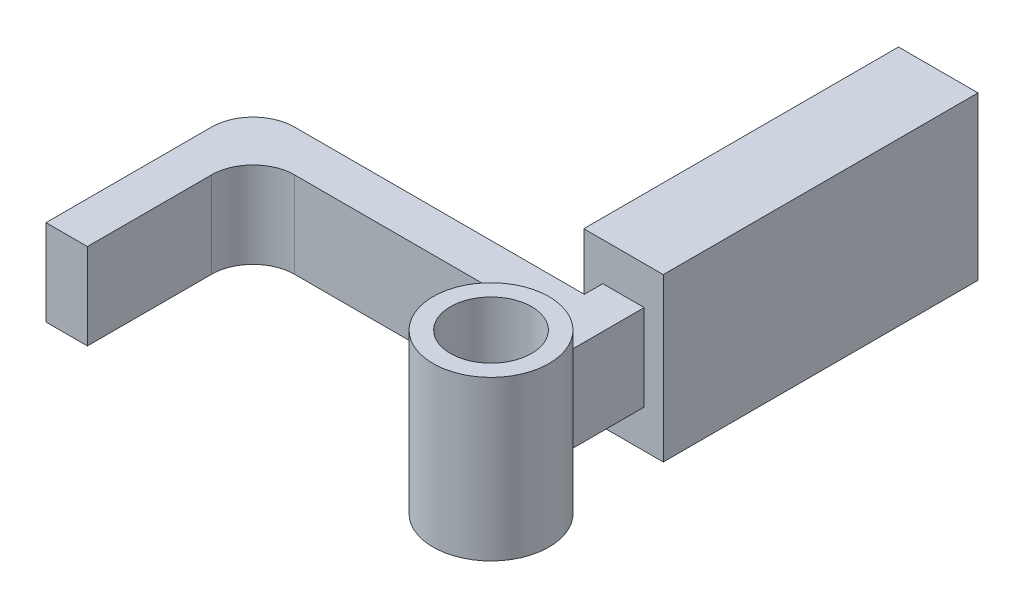
from build123d import *
from build123d.topology import SkipClean

# Parameters (mm, degrees)
SKETCH1_R                = 3.5
SKETCH1_R_2              = 2.45
HOLE_DEPTH               = 5.2
SKETCH2_W                = 2.5
SKETCH2_H                = 4.5
BOSS_EXTRUDE2_DEPTH      = 5.2
SKETCH3_W                = 4.8
SKETCH3_H                = 9.8
BOSS_EXTRUDE3_DEPTH      = 19
LEVER_ARM_DEPTH          = 5.2
BOSS_EXTRUDE4_DEPTH      = 2.2
BOSS_EXTRUDE4_DEPTH_BACK = 7.4
SKETCH6_R                = 3.5
SKETCH6_R_2              = 2.45
SCALE1_SCALE             = 0.8


with BuildPart() as part:
    # Sketch1 → hole (new body)
    with BuildSketch(Plane(origin=(0, 0, 0), x_dir=(1, 0, 0), z_dir=(0, 1, 0))):
        with Locations(Location((0, 0, 0), (0, 0, 270))):
            Circle(SKETCH1_R)
        with Locations(Location((0, 0, 0), (0, 0, 270))):
            Circle(SKETCH1_R_2, mode=Mode.SUBTRACT)
    extrude(amount=HOLE_DEPTH)

    # Sketch2 → Boss-Extrude2 (add)
    with BuildSketch(Plane.XZ):
        with Locations((0, -5.75)):
            Rectangle(SKETCH2_W, SKETCH2_H)
        with BuildLine():
            ThreePointArc((1.25, -3.269174208), (0.635566784, -3.441809824), (0, -3.5))
            Line((0, -3.5), (1.25, -3.5))
            Line((1.25, -3.5), (1.25, -3.269174208))
        make_face()
        with BuildLine():
            Line((-1.25, -3.269174208), (-1.25, -3.5))
            Line((-1.25, -3.5), (0, -3.5))
            ThreePointArc((0, -3.5), (-0.635566784, -3.441809824), (-1.25, -3.269174208))
        make_face()
    extrude(amount=-BOSS_EXTRUDE2_DEPTH)

    # Sketch3 → Boss-Extrude3 (add)
    with BuildSketch(Plane(origin=(0, 0, -8), x_dir=(-1, 0, 0), z_dir=(0, 0, -1))):
        with Locations((0, 2.6)):
            Rectangle(SKETCH3_W, SKETCH3_H)
    extrude(amount=BOSS_EXTRUDE3_DEPTH)

    # Sketch5 → lever arm (add)
    with BuildSketch(Plane.XZ):
        Polygon((-18.75, -6.884587104), (-1.25, -6.884587104), (-1.25, -4.384587104), (-16.25, -4.384587104), (-18.75, -4.384587104), align=None)
        with BuildLine():
            ThreePointArc((-21.25, -4.384587104), (-20.517766953, -6.152354057), (-18.75, -6.884587104))
            Line((-18.75, -6.884587104), (-18.75, -4.384587104))
            Line((-18.75, -4.384587104), (-21.25, -4.384587104))
        make_face()
        with BuildLine():
            Line((-18.75, -1.884587104), (-18.75, -4.384587104))
            Line((-18.75, -4.384587104), (-16.25, -4.384587104))
            ThreePointArc((-16.25, -4.384587104), (-18.017766953, -3.652354057), (-18.75, -1.884587104))
        make_face()
        Polygon((-21.25, -4.384587104), (-18.75, -4.384587104), (-18.75, -1.884587104), (-18.75, 5.615412896), (-21.25, 5.615412896), align=None)
    extrude(amount=-LEVER_ARM_DEPTH)

    # Sketch6 → Boss-Extrude4 (add, two sides: drawn at the far end of the back side and taken through both)
    with SkipClean():  # the faces are left unmerged after this step: merging them gives an invalid solid
        with BuildSketch(Plane.XZ.offset(-BOSS_EXTRUDE4_DEPTH_BACK)):
            with Locations(Location((0, 0, 0), (0, 0, 270))):
                Circle(SKETCH6_R)
            with Locations(Location((0, 0, 0), (0, 0, 270))):
                Circle(SKETCH6_R_2, mode=Mode.SUBTRACT)
        extrude(amount=BOSS_EXTRUDE4_DEPTH + BOSS_EXTRUDE4_DEPTH_BACK)
    add(part.part.scale(1), mode=Mode.REPLACE)  # the faces are merged on a copy


with BuildPart() as part_1:
    # Scale1: scaled about (-3.5957974, 2.6, -11.326296727)
    add(part.part.scale(SCALE1_SCALE).moved(Location((-0.71915948, 0.52, -2.265259345))))


solid = part_1.part
